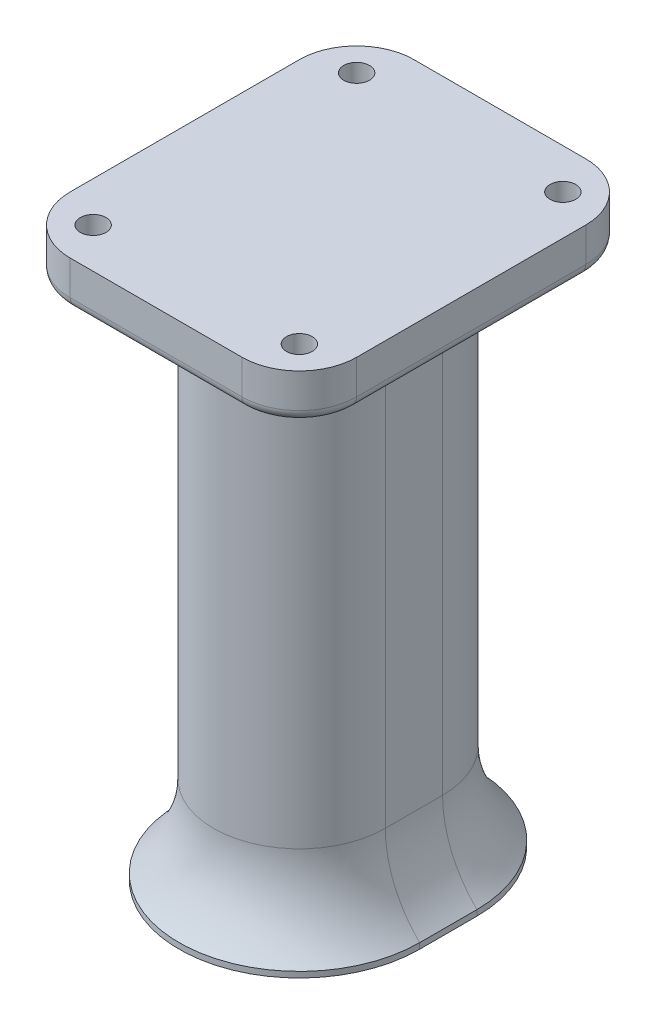
from build123d import *

# Parameters (mm, degrees)
BOSS_EXTRUDE1_DEPTH       = 90
BOSS_EXTRUDE2_DEPTH       = 1
SKETCH3_W                 = 50
SKETCH3_H                 = 60
BOSS_EXTRUDE3_DEPTH       = 8
FILLET1_R                 = 20
FILLET1_R_2               = 8
F_8_CLEARANCE_HOLE1_D     = 4.4958
F_8_CLEARANCE_HOLE1_DEPTH = 15
F_8_CLEARANCE_HOLE1_TIP   = 1.350674586
SKETCH8_R                 = 3.5
CUT_EXTRUDE2_DEPTH        = 12.7
CUT_EXTRUDE1_DEPTH        = 6
FILLET2_R                 = 10
FILLET3_R                 = 2


# Some blends are built 0.0001 mm under size
with BuildPart() as part:
    # Sketch1 → Boss-Extrude1 (new body)
    with BuildSketch(Plane(origin=(0, 0, 0), x_dir=(1, 0, 0), z_dir=(0, 1, 0))):
        with BuildLine():
            Line((-15, -5), (-15, 5))
            ThreePointArc((-15, 5), (0, 20), (15, 5))
            Line((15, 5), (15, -5))
            ThreePointArc((15, -5), (0, -20), (-15, -5))
        make_face()
    extrude(amount=BOSS_EXTRUDE1_DEPTH)

    # Sketch2 → Boss-Extrude2 (add)
    with BuildSketch(Plane.XZ):
        with BuildLine():
            Line((-21, 5), (-21, -5))
            ThreePointArc((-21, -5), (0, -26), (21, -5))
            Line((21, -5), (21, 5))
            ThreePointArc((21, 5), (0, 26), (-21, 5))
        make_face()
    extrude(amount=BOSS_EXTRUDE2_DEPTH)

    # Sketch3 → Boss-Extrude3 (add)
    with BuildSketch(Plane(origin=(0, 90, 0), x_dir=(1, 0, 0), z_dir=(0, 1, 0))):
        Rectangle(SKETCH3_W, SKETCH3_H)
    extrude(amount=BOSS_EXTRUDE3_DEPTH)

    # Fillet1
    # the kernel refuses this fillet: 20, 8 mm, written as the material it adds along each edge
    with BuildSketch(Plane(origin=(0, 0, 5), x_dir=(1, 0, 0), z_dir=(0, 0, -1))) as fillet1_piece_1:
        with BuildLine():
            CenterArc((35, -14.282856857), FILLET1_R, 134.427004001, 45.572995999)
            Line((21, 0), (20.72, 0.285657137))
            ThreePointArc((20.72, 0.285657137), (18, 0.4), (15, 0.4))
            Line((15, 0.4), (14.6, 0))
            Line((14.6, 0), (14.6, -14.282856857))
            Line((14.6, -14.282856857), (15, -14.282856857))
        make_face()
    revolve(axis=Axis((0, 0, 5), (0, -1, 0)), revolution_arc=180)
    with BuildSketch(Plane(origin=(0, 90, 5), x_dir=(1, 0, 0), z_dir=(0, 0, -1))) as fillet1_piece_2:
        with BuildLine():
            CenterArc((15 + FILLET1_R_2, FILLET1_R_2), FILLET1_R_2, 180, 90)
            Line((15, FILLET1_R_2), (15 - FILLET1_R_2 * 0.02, FILLET1_R_2))
            Line((15 - FILLET1_R_2 * 0.02, FILLET1_R_2), (15 - FILLET1_R_2 * 0.02, -FILLET1_R_2 * 0.02))
            Line((15 - FILLET1_R_2 * 0.02, -FILLET1_R_2 * 0.02), (15 + FILLET1_R_2, -FILLET1_R_2 * 0.02))
            Line((15 + FILLET1_R_2, -FILLET1_R_2 * 0.02), (15 + FILLET1_R_2, 0))
        make_face()
    revolve(axis=Axis((0, 90, 5), (0, -1, 0)), revolution_arc=180)
    with BuildSketch(Plane(origin=(15, 90, -5), x_dir=(1, 0, 0), z_dir=(0, 0, 1)), Plane(origin=(-15, 90, 5), x_dir=(-1, 0, 0), z_dir=(0, 0, -1))) as fillet1_piece_3:
        with BuildLine():
            CenterArc((FILLET1_R_2, -FILLET1_R_2), FILLET1_R_2, 90, 90)
            Line((0, -FILLET1_R_2), (-FILLET1_R_2 * 0.02, -FILLET1_R_2))
            Line((-FILLET1_R_2 * 0.02, -FILLET1_R_2), (-FILLET1_R_2 * 0.02, FILLET1_R_2 * 0.02))
            Line((-FILLET1_R_2 * 0.02, FILLET1_R_2 * 0.02), (FILLET1_R_2, FILLET1_R_2 * 0.02))
            Line((FILLET1_R_2, FILLET1_R_2 * 0.02), (FILLET1_R_2, 0))
        make_face()
    extrude(amount=10)
    with BuildSketch(Plane(origin=(0, 90, -5), x_dir=(-1, 0, 0), z_dir=(0, 0, 1))) as fillet1_piece_4:
        with BuildLine():
            CenterArc((15 + FILLET1_R_2, FILLET1_R_2), FILLET1_R_2, 180, 90)
            Line((15, FILLET1_R_2), (15 - FILLET1_R_2 * 0.02, FILLET1_R_2))
            Line((15 - FILLET1_R_2 * 0.02, FILLET1_R_2), (15 - FILLET1_R_2 * 0.02, -FILLET1_R_2 * 0.02))
            Line((15 - FILLET1_R_2 * 0.02, -FILLET1_R_2 * 0.02), (15 + FILLET1_R_2, -FILLET1_R_2 * 0.02))
            Line((15 + FILLET1_R_2, -FILLET1_R_2 * 0.02), (15 + FILLET1_R_2, 0))
        make_face()
    revolve(axis=Axis((0, 90, -5), (0, -1, 0)), revolution_arc=180)
    with BuildSketch(Plane(origin=(15, 0, -5), x_dir=(0, 1, 0), z_dir=(0, 0, 1)), Plane(origin=(-15, 0, 5), x_dir=(0, 1, 0), z_dir=(0, 0, -1))) as fillet1_piece_5:
        with BuildLine():
            CenterArc((14.282856857, -20), FILLET1_R, 90, 45.572995999)
            Line((0, -6), (-0.285657137, -5.72))
            ThreePointArc((-0.285657137, -5.72), (-0.4, -3), (-0.4, 0))
            Line((-0.4, 0), (0, 0.4))
            Line((0, 0.4), (14.282856857, 0.4))
            Line((14.282856857, 0.4), (14.282856857, 0))
        make_face()
    extrude(amount=10)
    with BuildSketch(Plane(origin=(0, 0, -5), x_dir=(-1, 0, 0), z_dir=(0, 0, 1))) as fillet1_piece_6:
        with BuildLine():
            CenterArc((35, -14.282856857), FILLET1_R, 134.427004001, 45.572995999)
            Line((21, 0), (20.72, 0.285657137))
            ThreePointArc((20.72, 0.285657137), (18, 0.4), (15, 0.4))
            Line((15, 0.4), (14.6, 0))
            Line((14.6, 0), (14.6, -14.282856857))
            Line((14.6, -14.282856857), (15, -14.282856857))
        make_face()
    revolve(axis=Axis((0, 0, -5), (0, -1, 0)), revolution_arc=180)

    # #8 Clearance Hole1
    with Locations(Plane(origin=(0, 98, 0), x_dir=(1, 0, 0), z_dir=(0, 1, 0))):
        with Locations((-18, 23), (18, 23), (18, -23), (-18, -23)):
            Hole(F_8_CLEARANCE_HOLE1_D / 2, depth=F_8_CLEARANCE_HOLE1_DEPTH)
            with Locations((0, 0, -(F_8_CLEARANCE_HOLE1_DEPTH + F_8_CLEARANCE_HOLE1_TIP / 2))):  # 118° drill point
                Cone(0, F_8_CLEARANCE_HOLE1_D / 2, F_8_CLEARANCE_HOLE1_TIP, mode=Mode.SUBTRACT)

    # Sketch8 → Cut-Extrude2 (cut)
    with BuildSketch(Plane.XZ.offset(1)):
        with Locations(Location((0, 0, 0), (0, 0, 270))):
            Circle(SKETCH8_R)
    extrude(amount=-CUT_EXTRUDE2_DEPTH, mode=Mode.SUBTRACT)

    # Sketch7 → Cut-Extrude1 (cut)
    with BuildSketch(Plane.XZ.offset(1)):
        Polygon((-3.464101615, -6), (3.464101615, -6), (6.92820323, 0), (3.464101615, 6), (-3.464101615, 6), (-6.92820323, 0), align=None)
    extrude(amount=-CUT_EXTRUDE1_DEPTH, mode=Mode.SUBTRACT)

    # Fillet2
    fillet2_edges = [part.edges().sort_by_distance(p)[0] for p in [
        (-25, 94, -30),
        (-25, 94, 30),
        (25, 94, 30),
        (25, 94, -30),
    ]]
    fillet(fillet2_edges, radius=FILLET2_R)

    # Fillet3
    fillet3_edges = [part.edges().sort_by_distance(p)[0] for p in [
        (0, 90, 30),
        (-25, 90, 0),
        (0, 90, -30),
        (25, 90, 0),
        (22.071067812, 90, 27.071067812),
        (22.071067812, 90, -27.071067812),
        (-22.071067812, 90, -27.071067812),
        (-22.071067812, 90, 27.071067812),
    ]]
    fillet(fillet3_edges, radius=FILLET3_R - 0.0001)  # a hair under: the kernel refuses the full size


solid = part.part
